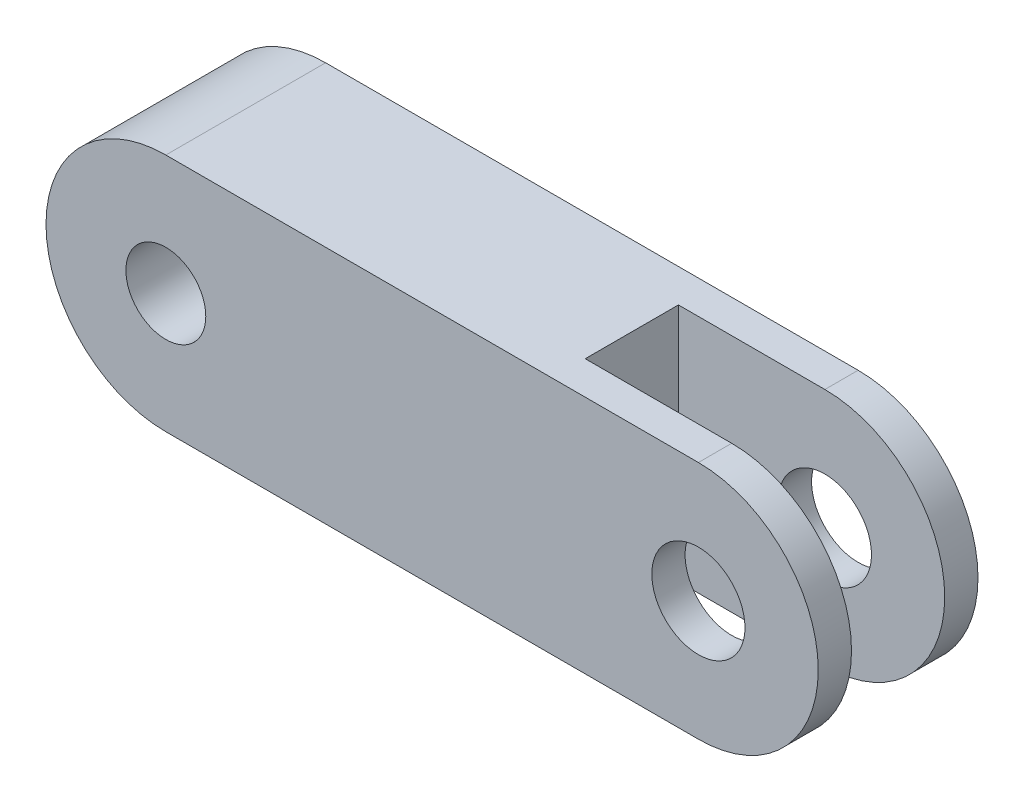
from build123d import *

# Parameters (mm, degrees)
SKETCH1_R           = 3.25
SKETCH1_R_2         = 1.75
BOSS_EXTRUDE1_DEPTH = 3
SKETCH5_W           = 10
SKETCH5_H           = 9
CUT_EXTRUDE1_DEPTH  = 1.75
BOSS_EXTRUDE2_START = -4
SKETCH6_R           = 3.25
SKETCH6_R_2         = 1.5
BOSS_EXTRUDE2_DEPTH = 4


with BuildPart() as part:
    # Sketch1 → Boss-Extrude1 (new, symmetric)
    with BuildSketch(Plane.XY):
        with BuildLine():
            Line((-10, 4.5), (10, 4.5))
            ThreePointArc((10, 4.5), (14.5, 0), (10, -4.5))
            Line((10, -4.5), (-10, -4.5))
            ThreePointArc((-10, -4.5), (-14.5, 0), (-10, 4.5))
        make_face()
        with Locations((-10, 0)):
            Circle(SKETCH1_R, mode=Mode.SUBTRACT)
        with Locations((10, 0)):
            Circle(SKETCH1_R_2, mode=Mode.SUBTRACT)
    extrude(amount=BOSS_EXTRUDE1_DEPTH, both=True)

    # Sketch5 → Cut-Extrude1 (cut, symmetric)
    with BuildSketch(Plane.XY):
        with Locations((9.5, 0)):
            Rectangle(SKETCH5_W, SKETCH5_H)
    extrude(amount=CUT_EXTRUDE1_DEPTH, both=True, mode=Mode.SUBTRACT)

    # Sketch6 → Boss-Extrude2 (add)
    with BuildSketch(Plane.XY.offset(3).offset(BOSS_EXTRUDE2_START)):
        with Locations((-10, 0)):
            Circle(SKETCH6_R)
        with Locations((-10, 0)):
            Circle(SKETCH6_R_2, mode=Mode.SUBTRACT)
    extrude(amount=BOSS_EXTRUDE2_DEPTH)


solid = part.part
